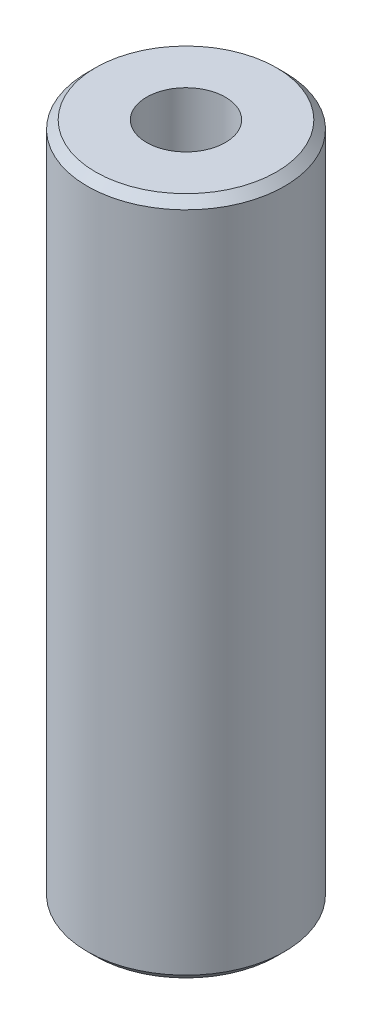
from build123d import *

# Parameters (mm, degrees)
SKETCH1_R           = 57.5
BOSS_EXTRUDE1_DEPTH = 395.940282165
SKETCH2_R           = 22.955793555
CUT_EXTRUDE1_DEPTH  = 405.204412446
CHAMFER1_SIZE       = 4.796288501


with BuildPart() as part:
    # Sketch1 → Boss-Extrude1 (new body)
    with BuildSketch(Plane(origin=(0, 0, 0), x_dir=(1, 0, 0), z_dir=(0, 1, 0))):
        Circle(SKETCH1_R)
    extrude(amount=BOSS_EXTRUDE1_DEPTH)

    # Sketch2 → Cut-Extrude1 (cut, through all)
    with BuildSketch(Plane(origin=(0, 0, 0), x_dir=(1, 0, 0), z_dir=(0, 1, 0))):
        Circle(SKETCH2_R)
    extrude(amount=CUT_EXTRUDE1_DEPTH, mode=Mode.SUBTRACT)

    # Chamfer1
    chamfer1_edges = [part.edges().sort_by_distance(p)[0] for p in [
        (-57.5, 395.940282165, 0),
        (-57.5, 0, 0),
    ]]
    chamfer(chamfer1_edges, length=CHAMFER1_SIZE)


solid = part.part
